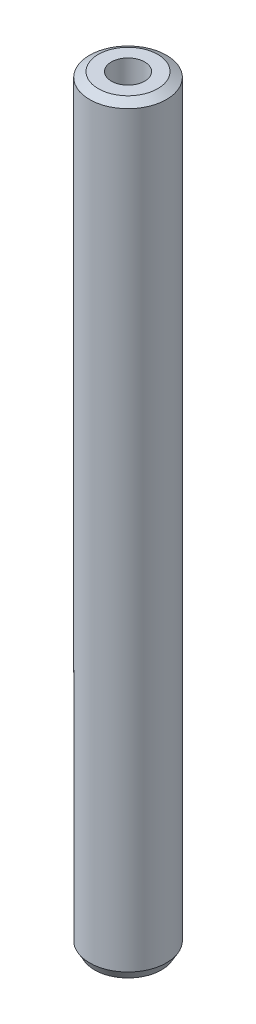
from build123d import *
from OCP.BRepFilletAPI import BRepFilletAPI_MakeChamfer

# Parameters (mm, degrees)
SKETCH1_R           = 20
BOSS_EXTRUDE1_DEPTH = 396.282376927
SKETCH2_R           = 8.674896296
CUT_EXTRUDE1_DEPTH  = 398.290475928
CHAMFER1_SIZE       = 2.616384814
CHAMFER1_SIZE2      = 4.53171143


with BuildPart() as part:
    # Sketch1 → Boss-Extrude1 (new body)
    with BuildSketch(Plane(origin=(0, 0, 0), x_dir=(1, 0, 0), z_dir=(0, 1, 0))):
        Circle(SKETCH1_R)
    extrude(amount=BOSS_EXTRUDE1_DEPTH)

    # Sketch2 → Cut-Extrude1 (cut, through all)
    with BuildSketch(Plane(origin=(0, 0, 0), x_dir=(1, 0, 0), z_dir=(0, 1, 0))):
        Circle(SKETCH2_R)
    extrude(amount=CUT_EXTRUDE1_DEPTH, mode=Mode.SUBTRACT)

    # Chamfer1: one chamfer whose edges measure the first distance from different faces: ONE call of the kernel's chamfer builder (chamfer() names one face for all edges)
    chamfer1_edges_1 = [part.edges().sort_by_distance(p)[0] for p in [
        (-20, 396.282376927, 0),
    ]]
    chamfer1_side_1 = [part.faces().sort_by_distance(p)[0] for p in [
        (-20, 198.141188464, 0),
    ]]
    chamfer1_edges_2 = [part.edges().sort_by_distance(p)[0] for p in [
        (-20, 0, 0),
    ]]
    chamfer1_side_2 = [part.faces().sort_by_distance(p)[0] for p in [
        (-19.434314575, 0, 0),
    ]]
    chamfer1 = BRepFilletAPI_MakeChamfer(part.part.solid().wrapped)
    for e in chamfer1_edges_1:
        chamfer1.Add(CHAMFER1_SIZE, CHAMFER1_SIZE2, e.wrapped, chamfer1_side_1[0].wrapped)  # the first distance lies on this face
    for e in chamfer1_edges_2:
        chamfer1.Add(CHAMFER1_SIZE, CHAMFER1_SIZE2, e.wrapped, chamfer1_side_2[0].wrapped)  # the first distance lies on this face
    add(Compound.cast(chamfer1.Shape()), mode=Mode.REPLACE)


solid = part.part
